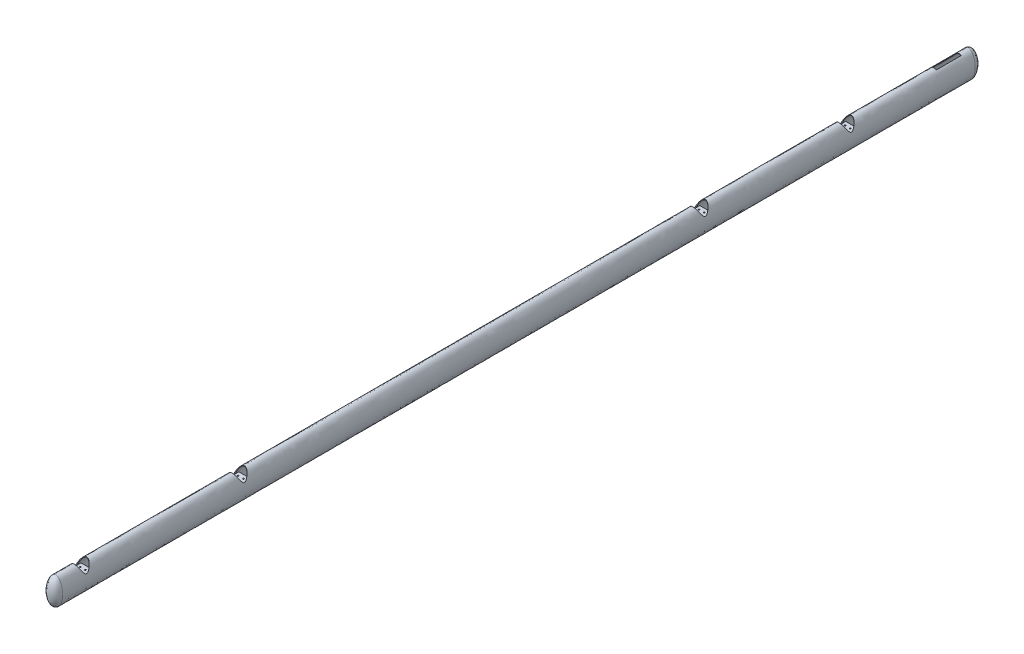
from build123d import *

# Parameters (mm, degrees)
SKETCH_1_RX                 = 30
SKETCH_1_RY                 = 15
SKETCH_1_RX_2               = 28.8
SKETCH_1_RY_2               = 13.8
EXTRUDE_1_DEPTH             = 2000
SKETCH_3_R                  = 13.85
CUT_EXTRUDE_1_DEPTH         = 18
EXTRUDE_2_REACH             = 2002.281
SKETCH_4_W                  = 28
SKETCH_4_H                  = 4
EXTRUDE_2_DIRECTION_2_REACH = 2002.281
SKETCH_6_R                  = 1.5
CUT_EXTRUDE_2_DEPTH         = 2016.913780538
REVOLVE_1_ANGLE             = 180
REVOLVE_2_ANGLE             = 180
CUT_EXTRUDE_3_REACH         = 2033.248
SKETCH_10_W                 = 10.5
SKETCH_10_H                 = 55


with BuildPart() as part:
    # Эскиз1 → Бобышка-Вытянуть1 (new body)
    with BuildSketch(Plane.XY):
        with Locations(Location((234.287725543, 0), (0, 0, -90))):
            Ellipse(SKETCH_1_RX, SKETCH_1_RY)
        with Locations(Location((234.287725543, 0), (0, 0, 90))):
            Ellipse(SKETCH_1_RX_2, SKETCH_1_RY_2, mode=Mode.SUBTRACT)
    extrude(amount=EXTRUDE_1_DEPTH)

    # Эскиз3 → Вырез-Вытянуть1 (cut)
    with BuildSketch(Plane(origin=(0, 30, 0), x_dir=(1, 0, 0), z_dir=(0, 1, 0))):
        with Locations((-234.287725543, -1946)):
            Circle(SKETCH_3_R)
        with Locations((234.287725543, -270)):
            Circle(SKETCH_3_R)
        with Locations((234.287725543, -590)):
            Circle(SKETCH_3_R)
        with Locations((234.287725543, -1600)):
            Circle(SKETCH_3_R)
        with Locations((234.287725543, -1946)):
            Circle(SKETCH_3_R)
    extrude(amount=-CUT_EXTRUDE_1_DEPTH, mode=Mode.SUBTRACT)

    # Эскиз4 → Бобышка-Вытянуть2 (add, up to next)
    with BuildSketch(Plane(origin=(234.287726, 0, 0), x_dir=(0, 0, -1), z_dir=(1, 0, 0)), mode=Mode.PRIVATE) as extrude_2_sk1:
        with Locations((-1945.85, 10)):
            Rectangle(SKETCH_4_W, SKETCH_4_H)
    extrude_2_tool1 = extrude(extrude_2_sk1.sketch, amount=EXTRUDE_2_REACH, mode=Mode.PRIVATE) - part.part
    # Эскиз4 → Бобышка-Вытянуть2 (add, up to next)
    with BuildSketch(Plane(origin=(234.287726, 0, 0), x_dir=(0, 0, -1), z_dir=(1, 0, 0)), mode=Mode.PRIVATE) as extrude_2_sk2:
        with Locations((-1600.15, 10)):
            Rectangle(SKETCH_4_W, SKETCH_4_H)
    extrude_2_tool2 = extrude(extrude_2_sk2.sketch, amount=EXTRUDE_2_REACH, mode=Mode.PRIVATE) - part.part
    # Эскиз4 → Бобышка-Вытянуть2 (add, up to next)
    with BuildSketch(Plane(origin=(234.287726, 0, 0), x_dir=(0, 0, -1), z_dir=(1, 0, 0)), mode=Mode.PRIVATE) as extrude_2_sk3:
        with Locations((-589.85, 10)):
            Rectangle(SKETCH_4_W, SKETCH_4_H)
    extrude_2_tool3 = extrude(extrude_2_sk3.sketch, amount=EXTRUDE_2_REACH, mode=Mode.PRIVATE) - part.part
    # Эскиз4 → Бобышка-Вытянуть2 (add, up to next)
    with BuildSketch(Plane(origin=(234.287726, 0, 0), x_dir=(0, 0, -1), z_dir=(1, 0, 0)), mode=Mode.PRIVATE) as extrude_2_sk4:
        with Locations((-270.15, 10)):
            Rectangle(SKETCH_4_W, SKETCH_4_H)
    extrude_2_tool4 = extrude(extrude_2_sk4.sketch, amount=EXTRUDE_2_REACH, mode=Mode.PRIVATE) - part.part
    add(extrude_2_tool1.solids().sort_by_distance((234.287726, 10, 1945.85))[0])
    add(extrude_2_tool2.solids().sort_by_distance((234.287726, 10, 1600.15))[0])
    add(extrude_2_tool3.solids().sort_by_distance((234.287726, 10, 589.85))[0])
    add(extrude_2_tool4.solids().sort_by_distance((234.287726, 10, 270.15))[0])

    # Эскиз4 → Бобышка-Вытянуть2 direction 2 (add, up to next)
    with BuildSketch(Plane(origin=(234.287726, 0, 0), x_dir=(0, 0, -1), z_dir=(1, 0, 0)), mode=Mode.PRIVATE) as extrude_2_direction_2_sk1:
        with Locations((-1945.85, 10)):
            Rectangle(SKETCH_4_W, SKETCH_4_H)
    extrude_2_direction_2_tool1 = extrude(extrude_2_direction_2_sk1.sketch, amount=-EXTRUDE_2_DIRECTION_2_REACH, mode=Mode.PRIVATE) - part.part
    # Эскиз4 → Бобышка-Вытянуть2 direction 2 (add, up to next)
    with BuildSketch(Plane(origin=(234.287726, 0, 0), x_dir=(0, 0, -1), z_dir=(1, 0, 0)), mode=Mode.PRIVATE) as extrude_2_direction_2_sk2:
        with Locations((-1600.15, 10)):
            Rectangle(SKETCH_4_W, SKETCH_4_H)
    extrude_2_direction_2_tool2 = extrude(extrude_2_direction_2_sk2.sketch, amount=-EXTRUDE_2_DIRECTION_2_REACH, mode=Mode.PRIVATE) - part.part
    # Эскиз4 → Бобышка-Вытянуть2 direction 2 (add, up to next)
    with BuildSketch(Plane(origin=(234.287726, 0, 0), x_dir=(0, 0, -1), z_dir=(1, 0, 0)), mode=Mode.PRIVATE) as extrude_2_direction_2_sk3:
        with Locations((-589.85, 10)):
            Rectangle(SKETCH_4_W, SKETCH_4_H)
    extrude_2_direction_2_tool3 = extrude(extrude_2_direction_2_sk3.sketch, amount=-EXTRUDE_2_DIRECTION_2_REACH, mode=Mode.PRIVATE) - part.part
    # Эскиз4 → Бобышка-Вытянуть2 direction 2 (add, up to next)
    with BuildSketch(Plane(origin=(234.287726, 0, 0), x_dir=(0, 0, -1), z_dir=(1, 0, 0)), mode=Mode.PRIVATE) as extrude_2_direction_2_sk4:
        with Locations((-270.15, 10)):
            Rectangle(SKETCH_4_W, SKETCH_4_H)
    extrude_2_direction_2_tool4 = extrude(extrude_2_direction_2_sk4.sketch, amount=-EXTRUDE_2_DIRECTION_2_REACH, mode=Mode.PRIVATE) - part.part
    add(extrude_2_direction_2_tool1.solids().sort_by_distance((234.287726, 10, 1945.85))[0])
    add(extrude_2_direction_2_tool2.solids().sort_by_distance((234.287726, 10, 1600.15))[0])
    add(extrude_2_direction_2_tool3.solids().sort_by_distance((234.287726, 10, 589.85))[0])
    add(extrude_2_direction_2_tool4.solids().sort_by_distance((234.287726, 10, 270.15))[0])

    # Эскиз6 → Вырез-Вытянуть2 (cut, through all)
    with BuildSketch(Plane(origin=(0, 12, 0), x_dir=(1, 0, 0), z_dir=(0, 1, 0))):
        with Locations((228.630871293, -1940.343145751)):
            Circle(SKETCH_6_R)
        with Locations((239.944579792, -1940.343145751)):
            Circle(SKETCH_6_R)
        with Locations((228.630871293, -1951.656854249)):
            Circle(SKETCH_6_R)
        with Locations((239.944579792, -1951.656854249)):
            Circle(SKETCH_6_R)
        with Locations((228.630871293, -1594.343145751)):
            Circle(SKETCH_6_R)
        with Locations((239.944579792, -1594.343145751)):
            Circle(SKETCH_6_R)
        with Locations((228.630871293, -1605.656854249)):
            Circle(SKETCH_6_R)
        with Locations((239.944579792, -1605.656854249)):
            Circle(SKETCH_6_R)
        with Locations((228.630871293, -584.343145751)):
            Circle(SKETCH_6_R)
        with Locations((239.944579792, -584.343145751)):
            Circle(SKETCH_6_R)
        with Locations((228.630871293, -595.656854249)):
            Circle(SKETCH_6_R)
        with Locations((239.944579792, -595.656854249)):
            Circle(SKETCH_6_R)
        with Locations((228.630871293, -264.343145751)):
            Circle(SKETCH_6_R)
        with Locations((239.944579792, -264.343145751)):
            Circle(SKETCH_6_R)
        with Locations((228.630871293, -275.656854249)):
            Circle(SKETCH_6_R)
        with Locations((239.944579792, -275.656854249)):
            Circle(SKETCH_6_R)
    extrude(amount=-CUT_EXTRUDE_2_DEPTH, mode=Mode.SUBTRACT)

    # Эскиз7 → Повернуть1 (revolve)
    with BuildSketch(Plane.XY.offset(2000)):
        with BuildLine():
            Line((234.287726, 30), (234.287726, 28.8))
            add(Edge.make_bspline(
                [(234.287726, -28.8), (248.087725543, -28.8), (248.087725543, 0), (248.087725543, 28.8), (234.287726, 28.8)],
                knots=[3.141592654, 3.141592654, 3.141592654, 4.71238898, 4.71238898, 6.283185307, 6.283185307, 6.283185307], degree=2, weights=[1, 0.707106781, 1, 0.707106781, 1]))
            Line((234.287726, -28.8), (234.287726, -30))
            add(Edge.make_bspline(
                [(234.287726, -30), (249.287725543, -30), (249.287725543, 0), (249.287725543, 30), (234.287726, 30)],
                knots=[3.141592654, 3.141592654, 3.141592654, 4.71238898, 4.71238898, 6.283185307, 6.283185307, 6.283185307], degree=2, weights=[1, 0.707106781, 1, 0.707106781, 1]))
        make_face()
    revolve(axis=Axis((234.287726, 30, 2000), (0, -1, 0)), revolution_arc=REVOLVE_1_ANGLE)

    # Эскиз8 → Повернуть2 (revolve)
    with BuildSketch(Plane(origin=(0, 0, 0), x_dir=(-1, 0, 0), z_dir=(0, 0, -1))):
        with BuildLine():
            Line((-234.287726, 30), (-234.287726, 28.8))
            add(Edge.make_bspline(
                [(-234.287726, -28.8), (-220.487725543, -28.8), (-220.487725543, 0), (-220.487725543, 28.8), (-234.287726, 28.8)],
                knots=[3.141592654, 3.141592654, 3.141592654, 4.71238898, 4.71238898, 6.283185307, 6.283185307, 6.283185307], degree=2, weights=[1, 0.707106781, 1, 0.707106781, 1]))
            Line((-234.287726, -28.8), (-234.287726, -30))
            add(Edge.make_bspline(
                [(-234.287726, -30), (-219.287725543, -30), (-219.287725543, 0), (-219.287725543, 30), (-234.287726, 30)],
                knots=[3.141592654, 3.141592654, 3.141592654, 4.71238898, 4.71238898, 6.283185307, 6.283185307, 6.283185307], degree=2, weights=[1, 0.707106781, 1, 0.707106781, 1]))
        make_face()
    revolve(axis=Axis((234.287726, 30, 0), (0, -1, 0)), revolution_arc=REVOLVE_2_ANGLE)

    # Эскиз10 → Вырез-Вытянуть3 (cut, up to next)
    with BuildSketch(Plane(origin=(0, 30, 0), x_dir=(1, 0, 0), z_dir=(0, 1, 0)), mode=Mode.PRIVATE) as cut_extrude_3_sk1:
        with Locations((234.287726, -48.499999543)):
            Rectangle(SKETCH_10_W, SKETCH_10_H)
    cut_extrude_3_tool1 = extrude(cut_extrude_3_sk1.sketch, amount=-CUT_EXTRUDE_3_REACH, mode=Mode.PRIVATE) & part.part
    add(cut_extrude_3_tool1.solids().sort_by_distance((234.287726, 30, 48.5))[0], mode=Mode.SUBTRACT)


solid = part.part
